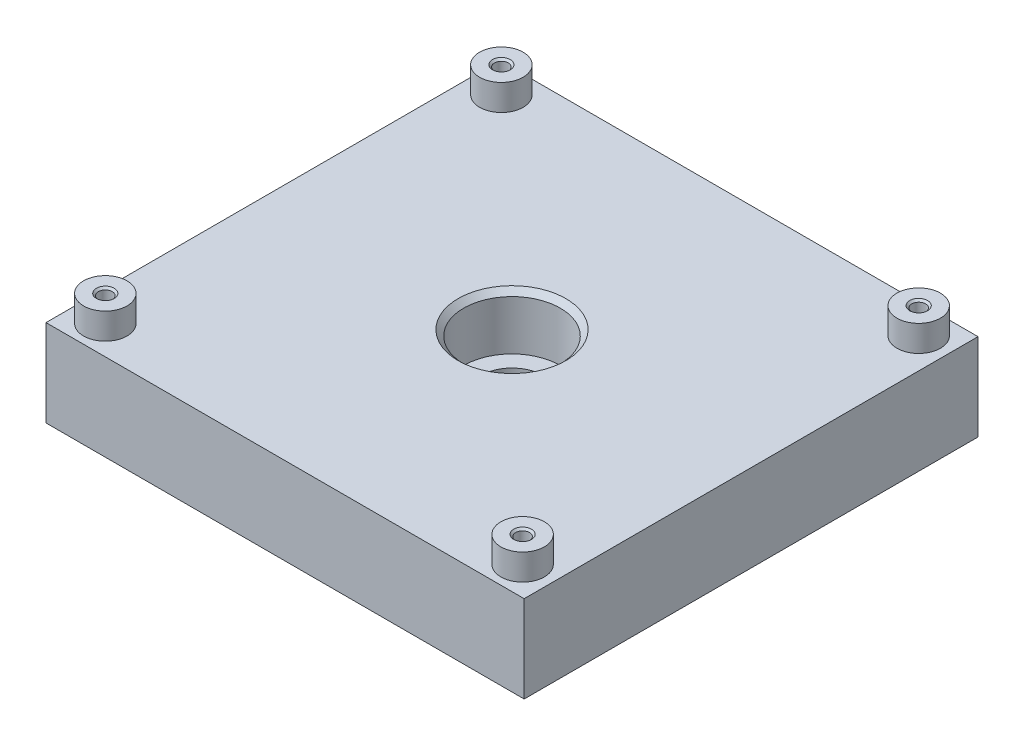
from build123d import *

# Parameters (mm, degrees)
SKETCH1_W                       = 55
SKETCH1_H                       = 52.2
BOSS_EXTRUDE1_DEPTH             = 10
SKETCH5_R                       = 2.5
BOSS_EXTRUDE2_DEPTH             = 3
M2X0_4_TAPPED_HOLE1_D           = 1.6
M2X0_4_TAPPED_HOLE1_CSINK_D     = 2.05
M2X0_4_TAPPED_HOLE1_CSINK_ANGLE = 90


with BuildPart() as part:
    # Sketch1 → Boss-Extrude1 (new body)
    with BuildSketch(Plane(origin=(0, 0, 0), x_dir=(1, 0, 0), z_dir=(0, 1, 0))):
        Rectangle(SKETCH1_W, SKETCH1_H)
    extrude(amount=BOSS_EXTRUDE1_DEPTH)

    # Sketch4 → CBORE for 1/4 Socket Head Cap Screw1 (revolve, cut)
    with BuildSketch(Plane(origin=(0, 10, 0), x_dir=(0, 0, 1), z_dir=(1, 0, 0))):
        Polygon((0, 0), (0, 10), (3.57124, 10), (3.57124, 6.35), (5.55625, 6.35), (5.55625, 0.635), (6.19125, 0), align=None)
    revolve(axis=Axis((0, 16.35, 0), (0, -1, 0)), mode=Mode.SUBTRACT)

    # Sketch5 → Boss-Extrude2 (add)
    with BuildSketch(Plane(origin=(0, 10, 0), x_dir=(1, 0, 0), z_dir=(0, 1, 0))):
        with Locations((-24, 22.778181818)):
            Circle(SKETCH5_R)
        with Locations((24, 22.778181818)):
            Circle(SKETCH5_R)
        with Locations((-24, -22.778181818)):
            Circle(SKETCH5_R)
        with Locations((24, -22.778181818)):
            Circle(SKETCH5_R)
    extrude(amount=BOSS_EXTRUDE2_DEPTH)

    # M2x0.4 Tapped Hole1 (through all)
    with Locations(Plane(origin=(0, 13, 0), x_dir=(1, 0, 0), z_dir=(0, 1, 0))):
        with Locations((-24, 22.778181818), (24, 22.778181818), (-24, -22.778181818), (24, -22.778181818)):
            CounterSinkHole(M2X0_4_TAPPED_HOLE1_D / 2, M2X0_4_TAPPED_HOLE1_CSINK_D / 2, counter_sink_angle=M2X0_4_TAPPED_HOLE1_CSINK_ANGLE)


solid = part.part
